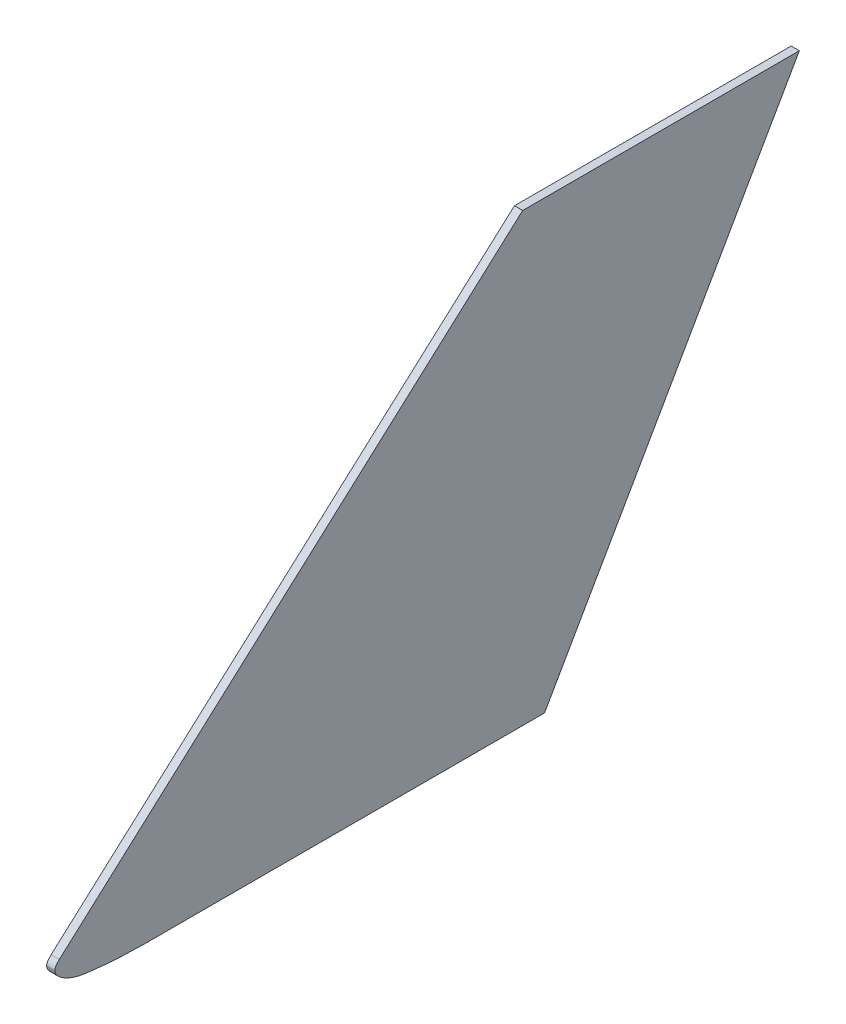
from build123d import *

# Parameters (mm, degrees)
BOSS_EXTRUDE1_DEPTH = 2.667
CUT_EXTRUDE1_DEPTH  = 290.953060218


with BuildPart() as part:
    # Sketch1 → Boss-Extrude1 (new body)
    with BuildSketch(Plane(origin=(0, 0, 0), x_dir=(0, 0, -1), z_dir=(1, 0, 0))):
        Polygon((0, 0), (168.275, 0), (251.079, 145), (161.163, 145), align=None)
    extrude(amount=BOSS_EXTRUDE1_DEPTH)

    # Sketch2 → Cut-Extrude1 (cut, through all)
    with BuildSketch(Plane.ZY):
        with BuildLine():
            add(Edge.make_bspline(
                [(-38.268496776, -3.7413e-05), (-29.333639406, -0.001953509), (-20.479171235, 1.104059742)],
                knots=[0, 0, 0, 1, 1, 1], degree=2))
            Line((-38.268496776, -3.7413e-05), (1.603827089, -0.136652983))
            Line((1.603827089, -0.136652983), (-7.656991971, 9.482815094))
            Line((-7.656991971, 9.482815094), (-10.613049229, 9.482815094))
            add(Edge.make_bspline(
                [(-9.096096952, 6.965105301), (-9.056659473, 7.842017541), (-9.649957621, 8.686611456), (-10.613049229, 9.482815094)],
                knots=[0.095003114, 0.095003114, 0.095003114, 0.095003114, 0.122643686, 0.122643686, 0.122643686, 0.122643686], degree=3))
            add(Edge.make_bspline(
                [(-20.479171234, 1.104059742), (-19.78420669, 1.190866413), (-14.294371688, 1.692059126), (-9.186269713, 4.960068489), (-9.096096952, 6.965105301)],
                knots=[0, 0, 0, 0, 0.031803671, 0.095003114, 0.095003114, 0.095003114, 0.095003114], degree=3))
        make_face()
    extrude(amount=-CUT_EXTRUDE1_DEPTH, mode=Mode.SUBTRACT)


solid = part.part
